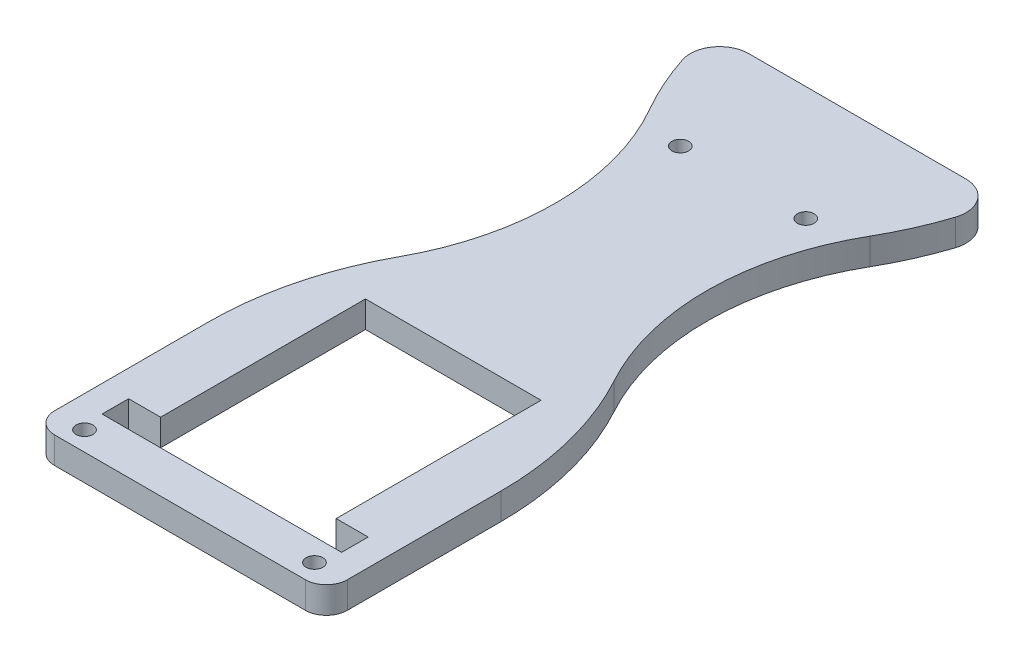
from build123d import *

# Parameters (mm, degrees)
BOSS_EXTRUDE1_DEPTH = 3.175
CUT_EXTRUDE1_DEPTH  = 204.138678001
SKETCH3_W           = 42
SKETCH3_H           = 55.35
SKETCH3_W_2         = 7.65
SKETCH3_H_2         = 6.35
CUT_EXTRUDE2_DEPTH  = 204.138678001
FILLET3_R           = 5
SKETCH5_R           = 2
CUT_EXTRUDE4_DEPTH  = 204.138678001
CUT_EXTRUDE5_DEPTH  = 204.138678001
FILLET5_R           = 76
FILLET6_R           = 7


with BuildPart() as part:
    # Sketch1 → Boss-Extrude1 (new, symmetric)
    with BuildSketch(Plane(origin=(0, 0, 0), x_dir=(1, 0, 0), z_dir=(0, 1, 0))):
        with BuildLine():
            Line((35, -200), (35, 0))
            ThreePointArc((35, 0), (0, 35), (-35, 0))
            Line((-35, 0), (-35, -200))
            Line((-35, -200), (35, -200))
        make_face()
    extrude(amount=BOSS_EXTRUDE1_DEPTH, both=True)

    # Sketch2 → Cut-Extrude1 (cut, through all)
    with BuildSketch(Plane(origin=(0, 3.175, 0), x_dir=(1, 0, 0), z_dir=(0, 1, 0))):
        with BuildLine():
            Line((-35, -38), (35, -38))
            Line((35, -38), (35, 0))
            ThreePointArc((35, 0), (0, 35), (-35, 0))
            Line((-35, 0), (-35, -38))
        make_face()
    extrude(amount=-CUT_EXTRUDE1_DEPTH, mode=Mode.SUBTRACT)

    # Sketch3 → Cut-Extrude2 (cut, through all)
    with BuildSketch(Plane(origin=(0, 3.175, 0), x_dir=(1, 0, 0), z_dir=(0, 1, 0))):
        with Locations((0, -162.325)):
            Rectangle(SKETCH3_W, SKETCH3_H)
        with Locations((-24.825, -186.825)):
            Rectangle(SKETCH3_W_2, SKETCH3_H_2)
        with Locations((24.825, -186.825)):
            Rectangle(SKETCH3_W_2, SKETCH3_H_2)
    extrude(amount=-CUT_EXTRUDE2_DEPTH, mode=Mode.SUBTRACT)

    # Fillet3
    fillet3_edges = [part.edges().sort_by_distance(p)[0] for p in [
        (35, 0, 200),
        (-35, 0, 200),
    ]]
    fillet(fillet3_edges, radius=FILLET3_R)

    # Sketch5 → Cut-Extrude4 (cut, through all)
    with BuildSketch(Plane(origin=(0, 3.175, 0), x_dir=(1, 0, 0), z_dir=(0, 1, 0))):
        with Locations(Location((27.5, -195.35, 0), (0, 0, 270))):
            Circle(SKETCH5_R)
        with Locations(Location((-27.5, -195.35, 0), (0, 0, 270))):
            Circle(SKETCH5_R)
        with Locations(Location((15, -65.35, 0), (0, 0, 270))):
            Circle(SKETCH5_R)
        with Locations(Location((-15, -65.35, 0), (0, 0, 270))):
            Circle(SKETCH5_R)
    extrude(amount=-CUT_EXTRUDE4_DEPTH, mode=Mode.SUBTRACT)

    # Sketch6 → Cut-Extrude5 (cut, through all)
    with BuildSketch(Plane(origin=(0, 3.175, 0), x_dir=(1, 0, 0), z_dir=(0, 1, 0))):
        with BuildLine():
            Line((-35, -134.65), (-35, -49.65))
            ThreePointArc((-35, -49.65), (-18.102907984, -92.15), (-35, -134.65))
        make_face()
    cut_extrude5 = extrude(amount=-CUT_EXTRUDE5_DEPTH, mode=Mode.SUBTRACT)

    # Mirror1: Cut-Extrude5 across plane
    add(cut_extrude5.mirror(Plane(origin=(0, 0, 0), x_dir=(0, 0, 1), z_dir=(1, 0, 0))), mode=Mode.SUBTRACT)

    # Fillet5
    # the kernel refuses this fillet: 76 mm, written as the material it takes off along each edge
    with BuildSketch(Plane(origin=(-35, 39.601520625, 49.65), x_dir=(0, 0, -1), z_dir=(0, -1, 0))) as fillet5_piece_1:
        with BuildLine():
            CenterArc((26.124451555, 74.608915367), FILLET5_R, 240.155370723, 18.865389254)
            Line((-11.696928446, 8.688181035), (-12.453356046, 7.369766348))
            ThreePointArc((-12.453356046, 7.369766348), (-6.498269887, 3.469254885), (-1.04366777, -1.105059992))
            Line((-1.04366777, -1.105059992), (0, -1.52))
            ThreePointArc((0, -1.52), (5.825, -1.52), (11.360510969, -1.492178307))
            Line((11.360510969, -1.492178307), (11.65, 0))
        make_face()
    extrude(amount=79.20304125, mode=Mode.SUBTRACT)
    with BuildSketch(Plane(origin=(-35, 62.277048415, 134.65), x_dir=(0.587963491001448, 0, -0.8088874663693276), z_dir=(0, -1, 0))) as fillet5_piece_2:
        with BuildLine():
            CenterArc((25.562462836, 75.375386129), FILLET5_R, 233.987375861, 28.66182532)
            Line((-19.12276248, 13.899938684), (-20.016466986, 12.670429736))
            Line((-20.016466986, 12.670429736), (-0.893704506, -1.229508949))
            Line((-0.893704506, -1.229508949), (0.194474848, -1.507507723))
            ThreePointArc((0.194474848, -1.507507723), (7.919360226, -1.011292338), (15.644245604, -1.507507723))
            Line((15.644245604, -1.507507723), (15.838720451, 0))
        make_face()
    extrude(amount=124.554096829, mode=Mode.SUBTRACT)
    with BuildSketch(Plane(origin=(35, 62.277048415, 134.65), x_dir=(-0.587963491001448, 0, -0.8088874663693276), z_dir=(0, -1, 0))) as fillet5_piece_3:
        with BuildLine():
            CenterArc((25.562462836, -75.375386129), FILLET5_R, 97.350798819, 28.66182532)
            Line((-19.12276248, -13.899938684), (-20.016466986, -12.670429736))
            Line((-20.016466986, -12.670429736), (-0.893704506, 1.229508949))
            Line((-0.893704506, 1.229508949), (0.194474848, 1.507507723))
            ThreePointArc((0.194474848, 1.507507723), (7.919360226, 1.011292338), (15.644245604, 1.507507723))
            Line((15.644245604, 1.507507723), (15.838720451, 0))
        make_face()
    extrude(amount=124.554096829, mode=Mode.SUBTRACT)
    with BuildSketch(Plane(origin=(35, 39.601520625, 49.65), x_dir=(0, 0, -1), z_dir=(0, -1, 0))) as fillet5_piece_4:
        with BuildLine():
            CenterArc((26.124451555, -74.608915367), FILLET5_R, 100.979240023, 18.865389254)
            Line((-11.696928446, -8.688181035), (-12.453356046, -7.369766348))
            ThreePointArc((-12.453356046, -7.369766348), (-6.498269887, -3.469254885), (-1.04366777, 1.105059992))
            Line((-1.04366777, 1.105059992), (0, 1.52))
            ThreePointArc((0, 1.52), (5.825, 1.52), (11.360510969, 1.492178307))
            Line((11.360510969, 1.492178307), (11.65, 0))
        make_face()
    extrude(amount=79.20304125, mode=Mode.SUBTRACT)

    # Fillet6
    fillet6_edges = [part.edges().sort_by_distance(p)[0] for p in [
        (35, 0, 38),
        (-35, 0, 38),
    ]]
    fillet(fillet6_edges, radius=FILLET6_R)


solid = part.part
